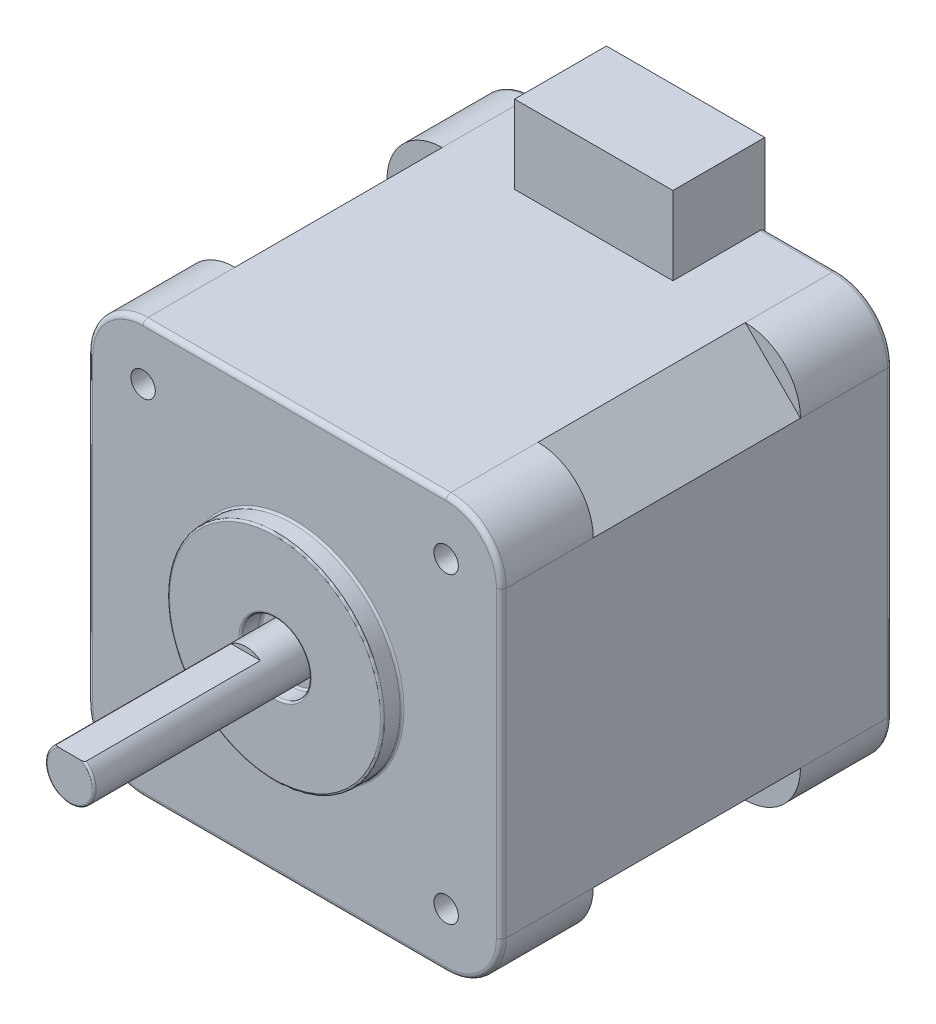
from build123d import *

# Parameters (mm, degrees)
SKETCH_1_W               = 42.3
SKETCH_1_H               = 42.3
EXTRUDE_1_DEPTH          = 10.6
CHAMFER_1_SIZE           = 5.65
SKETCH_3_W               = 42.3
SKETCH_3_H               = 42.3
EXTRUDE_2_DEPTH          = 9.4
FILLET_1_R               = 5.65
HOLE_WIZARD_M3_1_D       = 2.5
HOLE_WIZARD_M3_1_DEPTH   = 4.5
HOLE_WIZARD_M3_1_TIP     = 0.751075774
SKETCH_6_W               = 42.3
SKETCH_6_H               = 42.3
EXTRUDE_3_DEPTH          = 9.4
FILLET_2_R               = 5.65
SKETCH_7_W               = 16.2
SKETCH_7_H               = 9.4
EXTRUDE_4_DEPTH          = 8
SKETCH_8_R               = 11
EXTRUDE_5_DEPTH          = 2
FILLET_3_R               = 0.2
CUT_EXTRUDE_2_REACH      = 55.824
SKETCH_9_R               = 3.5
FILLET_4_R               = 0.2
SKETCH_11_R              = 2.5
EXTRUDE_7_DEPTH          = 23
FILLET_5_R               = 0.2
CUT_EXTRUDE_3_DEPTH      = 57.089615884
CUT_EXTRUDE_3_DEPTH_BACK = 57.089615884
SKETCH_12_W              = 18
SKETCH_12_H              = 0.5
FILLET_6_R               = 0.5


with BuildPart() as part:
    # 草图1 → 凸台-拉伸1 (new, symmetric)
    with BuildSketch(Plane.XY):
        Rectangle(SKETCH_1_W, SKETCH_1_H)
    extrude(amount=EXTRUDE_1_DEPTH, both=True)

    # 倒角1
    chamfer_1_edges = [part.edges().sort_by_distance(p)[0] for p in [
        (21.15, -21.15, 0),
        (-21.15, -21.15, 0),
        (-21.15, 21.15, 0),
        (21.15, 21.15, 0),
    ]]
    chamfer(chamfer_1_edges, length=CHAMFER_1_SIZE)

    # 草图3 → 凸台-拉伸2 (add)
    with BuildSketch(Plane.XY.offset(10.6)):
        Rectangle(SKETCH_3_W, SKETCH_3_H)
    extrude(amount=EXTRUDE_2_DEPTH)

    # 圆角1
    fillet_1_edges = [part.edges().sort_by_distance(p)[0] for p in [
        (21.15, 21.15, 15.3),
        (21.15, -21.15, 15.3),
        (-21.15, -21.15, 15.3),
        (-21.15, 21.15, 15.3),
    ]]
    fillet(fillet_1_edges, radius=FILLET_1_R)

    # M3 螺纹孔1
    with Locations(Plane.XY.offset(20)):
        with Locations((-15.5, -15.5), (15.5, -15.5), (15.5, 15.5), (-15.5, 15.5)):
            Hole(HOLE_WIZARD_M3_1_D / 2, depth=HOLE_WIZARD_M3_1_DEPTH)
            with Locations((0, 0, -(HOLE_WIZARD_M3_1_DEPTH + HOLE_WIZARD_M3_1_TIP / 2))):  # 118° drill point
                Cone(0, HOLE_WIZARD_M3_1_D / 2, HOLE_WIZARD_M3_1_TIP, mode=Mode.SUBTRACT)

    # 草图6 → 凸台-拉伸3 (add)
    with BuildSketch(Plane(origin=(0, 0, -10.6), x_dir=(-1, 0, 0), z_dir=(0, 0, -1))):
        Rectangle(SKETCH_6_W, SKETCH_6_H)
    extrude(amount=EXTRUDE_3_DEPTH)

    # 圆角2
    fillet_2_edges = [part.edges().sort_by_distance(p)[0] for p in [
        (-21.15, -21.15, -15.3),
        (21.15, -21.15, -15.3),
        (21.15, 21.15, -15.3),
        (-21.15, 21.15, -15.3),
    ]]
    fillet(fillet_2_edges, radius=FILLET_2_R)

    # 草图7 → 凸台-拉伸4 (add)
    with BuildSketch(Plane(origin=(0, 21.15, 0), x_dir=(1, 0, 0), z_dir=(0, 1, 0))):
        with Locations((0, 15.3)):
            Rectangle(SKETCH_7_W, SKETCH_7_H)
    extrude(amount=EXTRUDE_4_DEPTH)

    # 草图8 → 凸台-拉伸5 (add)
    with BuildSketch(Plane.XY.offset(20)):
        Circle(SKETCH_8_R)
    extrude(amount=EXTRUDE_5_DEPTH)

    # 圆角3
    fillet_3_edges = [part.edges().sort_by_distance(p)[0] for p in [
        (-11, 0, 20),
        (-11, 0, 22),
    ]]
    fillet(fillet_3_edges, radius=FILLET_3_R)

    # 草图9 → 切除-拉伸2 (cut, up to next)
    with BuildSketch(Plane.XY.offset(20), mode=Mode.PRIVATE) as cut_extrude_2_sk1:
        Circle(SKETCH_9_R)
    cut_extrude_2_tool1 = extrude(cut_extrude_2_sk1.sketch, amount=CUT_EXTRUDE_2_REACH, mode=Mode.PRIVATE) & part.part
    add(cut_extrude_2_tool1.solids().sort_by_distance((0, 0, 20))[0], mode=Mode.SUBTRACT)

    # 圆角4
    fillet_4_edges = [part.edges().sort_by_distance(p)[0] for p in [
        (-3.5, 0, 22),
        (-3.5, 0, 20),
    ]]
    fillet(fillet_4_edges, radius=FILLET_4_R)

    # 草图11 → 凸台-拉伸7 (add)
    with BuildSketch(Plane.XY.offset(20)):
        Circle(SKETCH_11_R)
    extrude(amount=EXTRUDE_7_DEPTH)

    # 圆角5
    fillet_5_edges = [part.edges().sort_by_distance(p)[0] for p in [
        (-2.5, 0, 43),
    ]]
    fillet(fillet_5_edges, radius=FILLET_5_R)

    # 草图12 → 切除-拉伸3 (cut, two sides: drawn at the far end of the back side and taken through both)
    with BuildSketch(Plane(origin=(0, 0, 0), x_dir=(0, 0, -1), z_dir=(1, 0, 0)).offset(-CUT_EXTRUDE_3_DEPTH_BACK)):
        with Locations((-34, 2.25)):
            Rectangle(SKETCH_12_W, SKETCH_12_H)
    extrude(amount=CUT_EXTRUDE_3_DEPTH + CUT_EXTRUDE_3_DEPTH_BACK, mode=Mode.SUBTRACT)

    # 圆角6
    fillet_6_edges = [part.edges().sort_by_distance(p)[0] for p in [
        (11.8, 21.15, -20),
        (19.495153314, 19.495153314, -20),
        (-11.8, 21.15, -20),
        (-19.495153314, 19.495153314, -20),
        (-21.15, 0, -20),
        (-19.495153314, -19.495153314, -20),
        (0, -21.15, -20),
        (19.495153314, -19.495153314, -20),
        (19.495153314, 19.495153314, 20),
        (21.15, 0, 20),
        (19.495153314, -19.495153314, 20),
        (0, -21.15, 20),
        (-19.495153314, -19.495153314, 20),
        (-21.15, 0, 20),
        (-19.495153314, 19.495153314, 20),
        (21.15, 0, -20),
        (0, 21.15, 20),
    ]]
    fillet(fillet_6_edges, radius=FILLET_6_R)


solid = part.part
